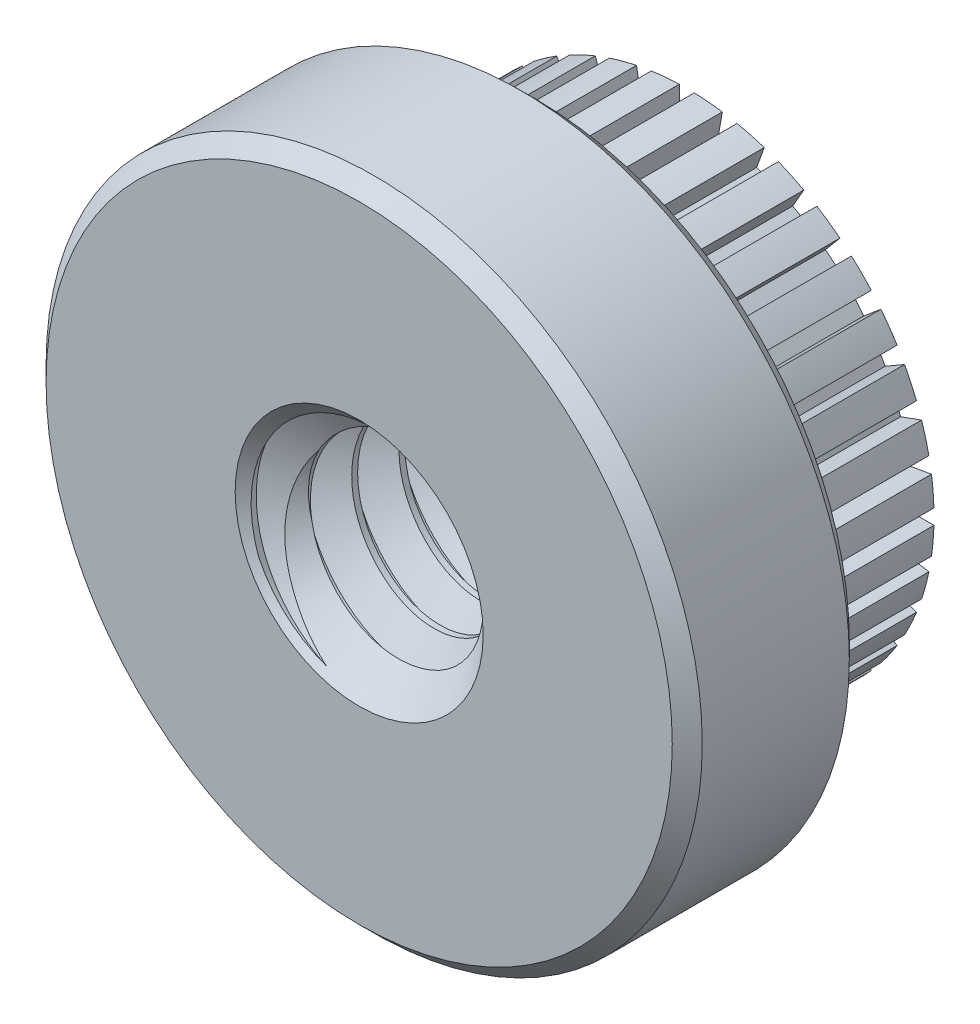
from build123d import *

# Parameters (mm, degrees)
SKETCH1_R               = 2.78
EXTRUDE1_DEPTH          = 1.5
SKETCH2_R               = 2.095
EXTRUDE2_DEPTH          = 1.53
SKETCH3_W               = 0.127
SKETCH3_H               = 0.8755
CUT_EXTRUDE_THIN1_DEPTH = 1.53
CIRPATTERN1_COUNT       = 36
SKETCH5_OUTSIDE_W       = 9.246
SKETCH5_OUTSIDE_H       = 9.246
SKETCH5_OUTSIDE_R       = 1.6505
CUT_EXTRUDE1_DEPTH      = 0.254
CHAMFER1_SIZE           = 0.127
SKETCH6_R               = 2.78
SKETCH6_R_2             = 1.6505
CUT_EXTRUDE2_DEPTH      = 0.127
CHAMFER2_SIZE           = 0.127
SKETCH7_R               = 1
CUT_EXTRUDE3_DEPTH      = 5.963637779
SWEEP1_PITCH            = 0.4
SKETCH10_R              = 2.653
CUT_EXTRUDE4_DEPTH      = 6.184821267
SKETCH11_R              = 1.5235
CUT_EXTRUDE5_DEPTH      = 5.96363784


with BuildPart() as part:
    # Sketch1 → Extrude1 (new body)
    with BuildSketch(Plane.XY):
        Circle(SKETCH1_R)
    extrude(amount=-EXTRUDE1_DEPTH)

    # Sketch2 → Extrude2 (add)
    with BuildSketch(Plane(origin=(0, 0, -1.5), x_dir=(-1, 0, 0), z_dir=(0, 0, -1))):
        with Locations(Location((0, 0, 0), (0, 0, 180))):
            Circle(SKETCH2_R)
    extrude(amount=EXTRUDE2_DEPTH)

    # Sketch3 → Cut-Extrude-Thin1 (cut)
    with BuildSketch(Plane(origin=(0, 0, -3.03), x_dir=(-1, 0, 0), z_dir=(0, 0, -1))):
        with Locations((0, 2.34225)):
            Rectangle(SKETCH3_W, SKETCH3_H)
    cut_extrude_thin1 = extrude(amount=-CUT_EXTRUDE_THIN1_DEPTH, mode=Mode.SUBTRACT)

    # CirPattern1: Cut-Extrude-Thin1 ×36 about axis
    cirpattern1_axis = Axis((0, 0, 0), (0, 0, 1))
    for i in range(1, CIRPATTERN1_COUNT):
        add(cut_extrude_thin1.rotate(cirpattern1_axis, i * 360 / CIRPATTERN1_COUNT), mode=Mode.SUBTRACT)

    # Sketch5 outside → Cut-Extrude1 (cut)
    with BuildSketch(Plane(origin=(0, 0, -3.03), x_dir=(-1, 0, 0), z_dir=(0, 0, -1))):
        Rectangle(SKETCH5_OUTSIDE_W, SKETCH5_OUTSIDE_H)
        Circle(SKETCH5_OUTSIDE_R, mode=Mode.SUBTRACT)
    extrude(amount=-CUT_EXTRUDE1_DEPTH, mode=Mode.SUBTRACT)

    # Chamfer1
    chamfer1_edges = [part.edges().sort_by_distance(p)[0] for p in [
        (1.6505, 0, -3.03),
    ]]
    chamfer(chamfer1_edges, length=CHAMFER1_SIZE)

    # Sketch6 → Cut-Extrude2 (cut)
    with BuildSketch(Plane(origin=(0, 0, -1.5), x_dir=(-1, 0, 0), z_dir=(0, 0, -1))):
        with Locations(Location((0, 0, 0), (0, 0, 180))):
            Circle(SKETCH6_R)
        Circle(SKETCH6_R_2, mode=Mode.SUBTRACT)
    extrude(amount=CUT_EXTRUDE2_DEPTH, mode=Mode.SUBTRACT)

    # Chamfer2
    chamfer2_edges = [part.edges().sort_by_distance(p)[0] for p in [
        (-2.78, 0, 0),
        (-2.78, 0, -1.5),
    ]]
    chamfer(chamfer2_edges, length=CHAMFER2_SIZE)

    # Sketch7 → Cut-Extrude3 (cut, through all)
    with BuildSketch(Plane.XY):
        Circle(SKETCH7_R)
    extrude(amount=-CUT_EXTRUDE3_DEPTH, mode=Mode.SUBTRACT)

    # Sweep1: the profile of Sketch9 profile screwed along a right-hand helix of 11.25 turns, 6 arcs to a turn; built about Z, then put on its axis
    sweep1_z = Axis((0, 0, 0), (0, 0, 1))
    sweep1_corners = [(1.0003, 0, -0.350173205), (0.740192379, 0, -0.2), (0.740192379, 0, -0.15), (1.0003, 0, 0.000173205)]
    with BuildLine(mode=Mode.PRIVATE) as sweep1_profile:
        Line(sweep1_corners[0], sweep1_corners[1])
        Line(sweep1_corners[1], sweep1_corners[2])
        Line(sweep1_corners[2], sweep1_corners[3])
        Line(sweep1_corners[3], sweep1_corners[0])
    sweep1_cap = Face(sweep1_profile.wire())
    sweep1_turn_angles = [0, 30, 60, 90, 120, 150, 180, 210, 240, 270, 300, 330, 360]
    sweep1_turn_weights = [1, 0.8660254037844387, 1, 0.8660254037844387, 1, 0.8660254037844387, 1, 0.8660254037844387, 1, 0.8660254037844387, 1, 0.8660254037844387, 1]
    sweep1_turn_rails = [Edge.make_bspline([Vector(p[0], p[1], 0).rotate(sweep1_z, sweep1_turn_angles[k]) / sweep1_turn_weights[k] + Vector(0, 0, p[2] + SWEEP1_PITCH * sweep1_turn_angles[k] / 360) for k in range(13)], [0, 0, 0, 1, 1, 2, 2, 3, 3, 4, 4, 5, 5, 6, 6, 6], 2, sweep1_turn_weights) for p in sweep1_corners]
    sweep1_turn_sides = [Face.make_surface_from_curves(sweep1_turn_rails[p[0]], sweep1_turn_rails[p[1]]) for p in [(0, 1), (1, 2), (2, 3), (3, 0)]]
    sweep1_last_angles = [3960, 3990, 4020, 4035, 4050]
    sweep1_last_weights = [1, 0.8660254037844387, 1, 0.9659258262891135, 1]
    sweep1_last_rails = [Edge.make_bspline([Vector(p[0], p[1], 0).rotate(sweep1_z, sweep1_last_angles[k]) / sweep1_last_weights[k] + Vector(0, 0, p[2] + SWEEP1_PITCH * sweep1_last_angles[k] / 360) for k in range(5)], [0, 0, 0, 1, 1, 2, 2, 2], 2, sweep1_last_weights) for p in sweep1_corners]
    sweep1_last_sides = [Face.make_surface_from_curves(sweep1_last_rails[p[0]], sweep1_last_rails[p[1]]) for p in [(0, 1), (1, 2), (2, 3), (3, 0)]]
    sweep1 = Plane(origin=(0, 0, -3.03), x_dir=(0, 1, 0), z_dir=(0, 0, 1)) * Solid(Shell([*[p.moved(Location((0, 0, SWEEP1_PITCH * i))) for i in range(11) for p in sweep1_turn_sides], *sweep1_last_sides, sweep1_cap, sweep1_cap.rotate(sweep1_z, 4050).moved(Location((0, 0, SWEEP1_PITCH * 4050 / 360)))]))
    add(sweep1)

    # Sketch10 → Cut-Extrude4 (cut, through all)
    with BuildSketch(Plane.XY):
        Circle(SKETCH10_R)
    extrude(amount=CUT_EXTRUDE4_DEPTH, mode=Mode.SUBTRACT)

    # Sketch11 → Cut-Extrude5 (cut, through all)
    with BuildSketch(Plane(origin=(0, 0, -3.03), x_dir=(-1, 0, 0), z_dir=(0, 0, -1))):
        Circle(SKETCH11_R)
    extrude(amount=CUT_EXTRUDE5_DEPTH, mode=Mode.SUBTRACT)

    # Cut-Extrude6 cone 1 section (through the dimple's axis) → Cut-Extrude6 (revolve, cut)
    with BuildSketch(Plane(origin=(0, 0, 0), x_dir=(0, -1, 0), z_dir=(1, 0, 0))):
        Polygon((0, 0), (1.0508, 0), (0, 1.0508), align=None)
    revolve(axis=Axis((0, 0, 0), (0, 0, -1)), mode=Mode.SUBTRACT)

    # Cut-Extrude7 cone 1 section (through the dimple's axis) → Cut-Extrude7 (revolve, cut)
    with BuildSketch(Plane(origin=(0, 0, -3.03), x_dir=(0, 1, 0), z_dir=(1, 0, 0))):
        Polygon((0, 0), (1.0508, 0), (0, 1.0508), align=None)
    revolve(axis=Axis((0, 0, -3.03), (0, 0, 1)), mode=Mode.SUBTRACT)


solid = part.part
